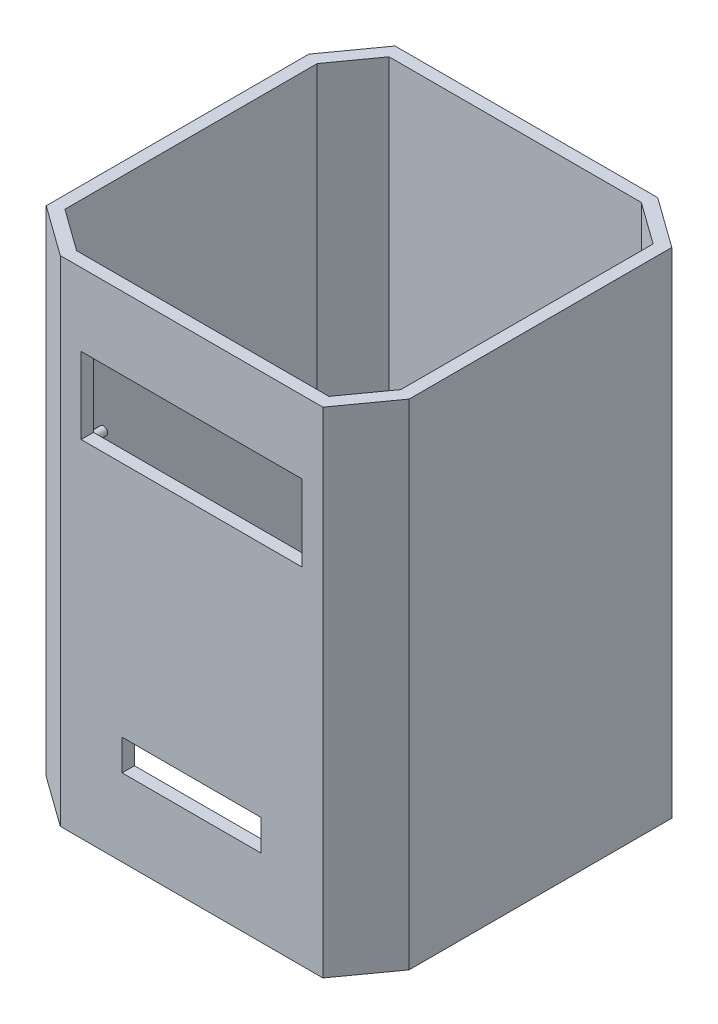
from build123d import *

# Parameters (mm, degrees)
BOSS_EXTRUDE2_DEPTH = 160
CUT_EXTRUDE3_DEPTH  = 191.888488117
BOSS_EXTRUDE3_START = -4
SKETCH11_R          = 1.35
BOSS_EXTRUDE3_DEPTH = 5
CUT_EXTRUDE5_REACH  = 214.655
SKETCH12_W          = 71.5
SKETCH12_H          = 24.7
CUT_EXTRUDE7_REACH  = 214.655
SKETCH14_W          = 45
SKETCH14_H          = 10


with BuildPart() as part:
    # Sketch1 → Boss-Extrude2 (new body)
    with BuildSketch(Plane(origin=(0, 0, 0), x_dir=(1, 0, 0), z_dir=(0, 1, 0))):
        Polygon((-66.665628827, -62.97613271), (18.334371173, -62.97613271), (30.01524957, -46.741691548), (30.01524957, 38.258308452), (13.780808408, 49.93918685), (-71.219191592, 49.93918685), (-82.90006999, 33.704745687), (-82.90006999, -51.295254313), align=None)
    extrude(amount=BOSS_EXTRUDE2_DEPTH)

    # Sketch10 → Cut-Extrude3 (cut, through all)
    with BuildSketch(Plane(origin=(0, 160, 0), x_dir=(1, 0, 0), z_dir=(0, 1, 0))):
        Polygon((-78.90006999, -49.245507969), (-65.376150859, -58.97613271), (16.284624829, -58.97613271), (26.01524957, -45.452213579), (26.01524957, 36.208562109), (12.491330439, 45.93918685), (-69.169445249, 45.93918685), (-78.90006999, 32.415267718), align=None)
    extrude(amount=-CUT_EXTRUDE3_DEPTH, mode=Mode.SUBTRACT)

    # Sketch11 → Boss-Extrude3 (add)
    with BuildSketch(Plane.XY.offset(62.97613271).offset(BOSS_EXTRUDE3_START)):
        with Locations((-61.665628827, 139.908502795)):
            Circle(SKETCH11_R)
        with Locations((13.334371173, 139.908502795)):
            Circle(SKETCH11_R)
        with Locations((13.334371173, 108.908502795)):
            Circle(SKETCH11_R)
        with Locations((-61.665628827, 108.908502795)):
            Circle(SKETCH11_R)
    extrude(amount=-BOSS_EXTRUDE3_DEPTH)

    # Sketch12 → Cut-Extrude5 (cut, up to next)
    with BuildSketch(Plane.XY.offset(62.97613271), mode=Mode.PRIVATE) as cut_extrude5_sk1:
        with Locations((-24.165628827, 124.158502795)):
            Rectangle(SKETCH12_W, SKETCH12_H)
    cut_extrude5_tool1 = extrude(cut_extrude5_sk1.sketch, amount=-CUT_EXTRUDE5_REACH, mode=Mode.PRIVATE) & part.part
    add(cut_extrude5_tool1.solids().sort_by_distance((-24.165629, 124.158503, 62.976133))[0], mode=Mode.SUBTRACT)

    # Sketch14 → Cut-Extrude7 (cut, up to next)
    with BuildSketch(Plane.XY.offset(62.97613271), mode=Mode.PRIVATE) as cut_extrude7_sk1:
        with Locations((-24.165628827, 30)):
            Rectangle(SKETCH14_W, SKETCH14_H)
    cut_extrude7_tool1 = extrude(cut_extrude7_sk1.sketch, amount=-CUT_EXTRUDE7_REACH, mode=Mode.PRIVATE) & part.part
    add(cut_extrude7_tool1.solids().sort_by_distance((-24.165629, 30, 62.976133))[0], mode=Mode.SUBTRACT)


solid = part.part
